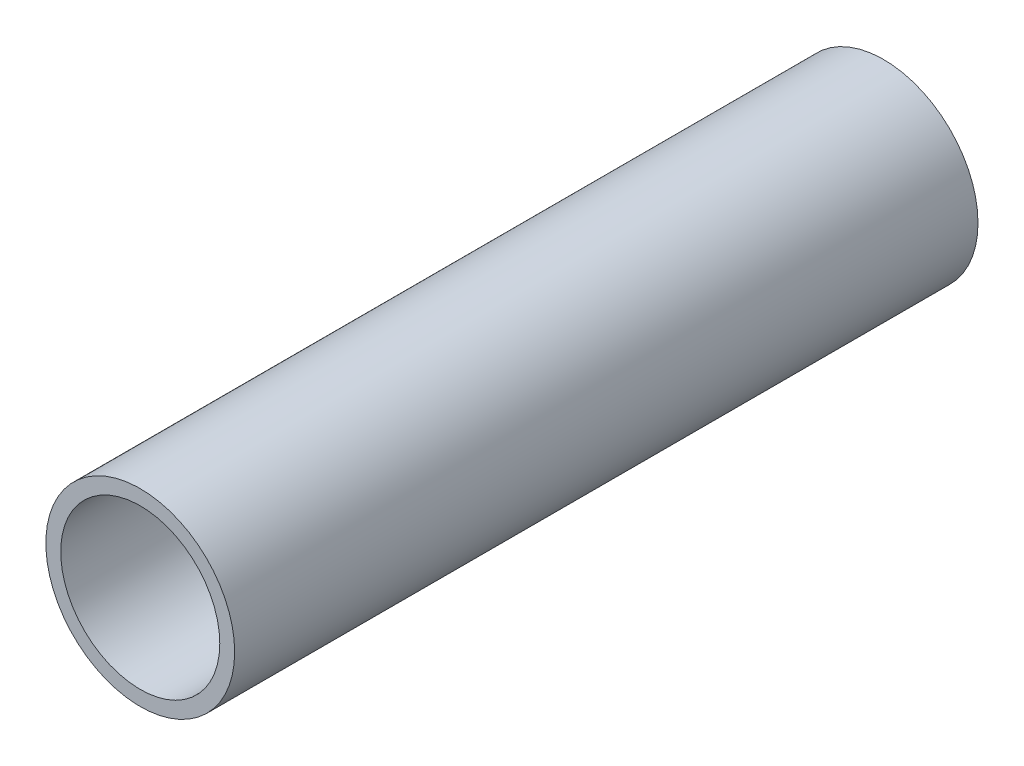
from build123d import *

# Parameters (mm, degrees)
SKETCH1_R           = 12.7
SKETCH1_R_2         = 10.7
BOSS_EXTRUDE1_DEPTH = 100


with BuildPart() as part:
    # Sketch1 → Boss-Extrude1 (new body)
    with BuildSketch(Plane.XY):
        Circle(SKETCH1_R)
        Circle(SKETCH1_R_2, mode=Mode.SUBTRACT)
    extrude(amount=BOSS_EXTRUDE1_DEPTH)


solid = part.part
